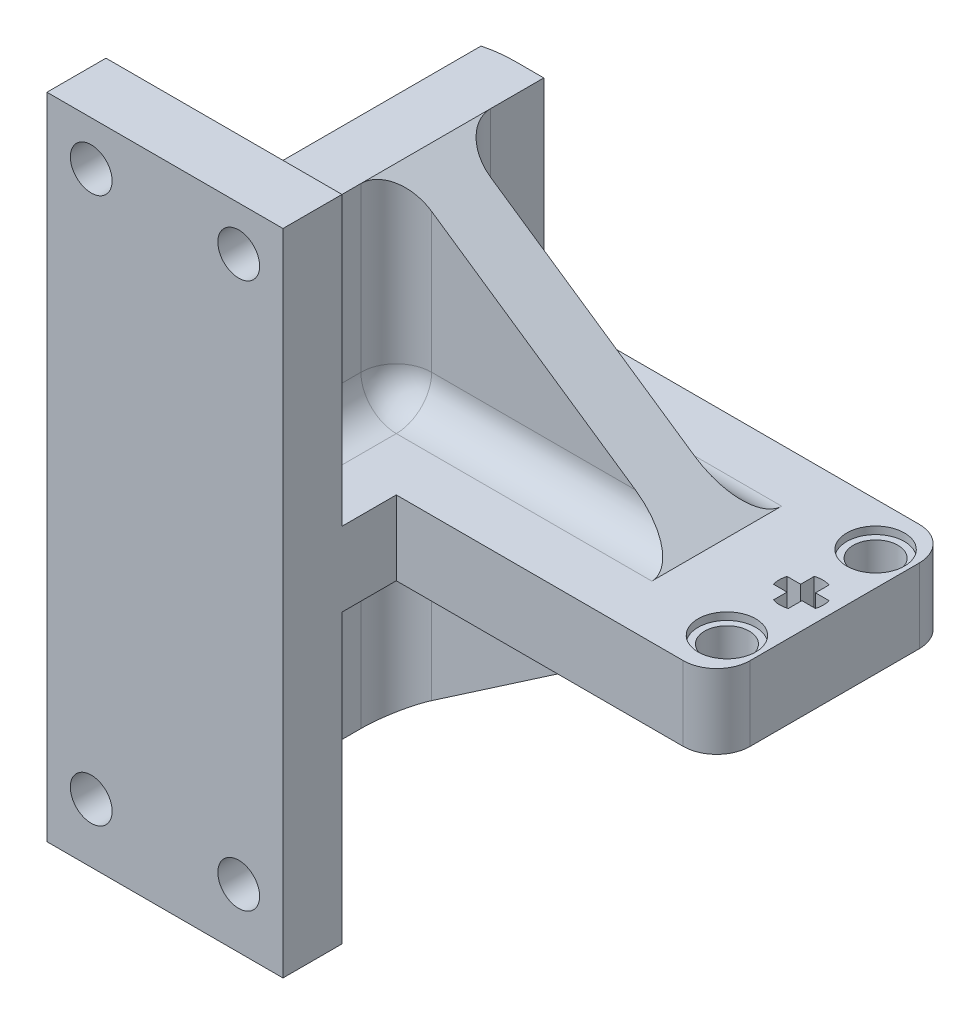
from build123d import *

# Parameters (mm, degrees)
BOSS_EXTRUDE1_DEPTH   = 4
SKETCH2_W             = 8
SKETCH2_H             = 25.4
BOSS_EXTRUDE2_DEPTH   = 8
SKETCH4_R             = 2.4
CUT_EXTRUDE1_DEPTH    = 61.853191075
SKETCH4_3_R           = 3.1
SKETCH4_3_R_2         = 2.4
CUT_EXTRUDE2_DEPTH    = 0.8
SKETCH5_W             = 25.4
SKETCH5_H             = 69.85
BOSS_EXTRUDE3_DEPTH   = 6.35
SKETCH8_W             = 31.242
SKETCH8_H             = 21.4
BOSS_EXTRUDE5_DEPTH   = 3.175
BOSS_EXTRUDE6_DEPTH   = 3.175
FILLET4_R             = 3.81
FILLET1_START         = -12.7
FILLET1_DEPTH         = 9.117148006
FILLET1_2_ANGLE       = 90
FILLET1_3_ANGLE       = 90
FILLET2_R             = 3.6
FILLET3_R             = 12.7
F_8_CLEARANCE_HOLE1_D = 4.4958


with BuildPart() as part:
    # Sketch1 → Boss-Extrude1 (new, symmetric)
    with BuildSketch(Plane(origin=(0, 0, 0), x_dir=(1, 0, 0), z_dir=(0, 1, 0))):
        Polygon((-12.7, 0), (12.7, 0), (12.7, 6.35), (12.7, 12.192), (43.18, 12.192), (43.18, 37.592), (-12.7, 37.592), (-12.7, 6.35), align=None)
    extrude(amount=BOSS_EXTRUDE1_DEPTH, both=True)

    # Sketch2 → Boss-Extrude2 (add)
    with BuildSketch(Plane(origin=(0, 4, 0), x_dir=(1, 0, 0), z_dir=(0, 1, 0))):
        with Locations((43.18, 24.892)):
            Rectangle(SKETCH2_W, SKETCH2_H)
    extrude(amount=-BOSS_EXTRUDE2_DEPTH)

    # Sketch4 → Cut-Extrude1 (cut, through all)
    with BuildSketch(Plane(origin=(0, 4, 0), x_dir=(1, 0, 0), z_dir=(0, 1, 0))):
        with Locations(Location((43.58, 16.892, 0), (0, 0, 270))):
            Circle(SKETCH4_R)
        with BuildLine():
            ThreePointArc((45.8427417, 25.62337085), (45.947727335, 24.892), (45.8427417, 24.16062915))
            Line((45.8427417, 24.16062915), (44.38, 24.16062915))
            Line((44.38, 24.16062915), (44.38, 22.69788745))
            ThreePointArc((44.38, 22.69788745), (43.58, 22.571750825), (42.78, 22.69788745))
            Line((42.78, 22.69788745), (42.78, 24.16062915))
            Line((42.78, 24.16062915), (41.3172583, 24.16062915))
            ThreePointArc((41.3172583, 24.16062915), (41.212272665, 24.892), (41.3172583, 25.62337085))
            Line((41.3172583, 25.62337085), (42.78, 25.62337085))
            Line((42.78, 25.62337085), (42.78, 27.08611255))
            ThreePointArc((42.78, 27.08611255), (43.58, 27.212249175), (44.38, 27.08611255))
            Line((44.38, 27.08611255), (44.38, 25.62337085))
            Line((44.38, 25.62337085), (45.8427417, 25.62337085))
        make_face()
        with Locations(Location((43.58, 32.892, 0), (0, 0, 270))):
            Circle(SKETCH4_R)
        with BuildLine():
            Line((42.78, 27.08611255), (42.78, 25.62337085))
            Line((42.78, 25.62337085), (44.38, 25.62337085))
            Line((44.38, 25.62337085), (44.38, 27.08611255))
            ThreePointArc((44.38, 27.08611255), (43.58, 27.212249175), (42.78, 27.08611255))
        make_face()
    extrude(amount=-CUT_EXTRUDE1_DEPTH, mode=Mode.SUBTRACT)

    # Sketch4<3> → Cut-Extrude2 (cut)
    # profile 1 of 2: a face of its own
    with BuildSketch(Plane(origin=(0, 4, 0), x_dir=(1, 0, 0), z_dir=(0, 1, 0))):
        with Locations(Location((43.58, 16.892, 0), (0, 0, 270))):
            Circle(SKETCH4_3_R)
        with Locations(Location((43.58, 16.892, 0), (0, 0, 270))):
            Circle(SKETCH4_3_R_2, mode=Mode.SUBTRACT)
    # profile 2 of 2: a face of its own
    with BuildSketch(Plane(origin=(0, 4, 0), x_dir=(1, 0, 0), z_dir=(0, 1, 0))):
        with Locations(Location((43.58, 32.892, 0), (0, 0, 270))):
            Circle(SKETCH4_3_R)
        with Locations(Location((43.58, 32.892, 0), (0, 0, 270))):
            Circle(SKETCH4_3_R_2, mode=Mode.SUBTRACT)
    cut_extrude2 = extrude(amount=-CUT_EXTRUDE2_DEPTH, mode=Mode.SUBTRACT)

    # Mirror1: Cut-Extrude2 across plane
    add(cut_extrude2.mirror(Plane.ZX), mode=Mode.SUBTRACT)

    # Sketch5 → Boss-Extrude3 (add)
    with BuildSketch(Plane.XY):
        Rectangle(SKETCH5_W, SKETCH5_H)
    extrude(amount=-BOSS_EXTRUDE3_DEPTH)

    # Sketch8 → Boss-Extrude5 (add, symmetric)
    with BuildSketch(Plane(origin=(0, 0, 0), x_dir=(0, 0, -1), z_dir=(1, 0, 0))):
        with Locations((21.971, 14.7)):
            Rectangle(SKETCH8_W, SKETCH8_H)
    boss_extrude5 = extrude(amount=BOSS_EXTRUDE5_DEPTH, both=True)

    # Sketch9 → Boss-Extrude6 (add, symmetric)
    with BuildSketch(Plane(origin=(0, 0, -24.892), x_dir=(-1, 0, 0), z_dir=(0, 0, -1))):
        Polygon((-3.175, 25.4), (-34.48, 4), (-3.175, 4), align=None)
    boss_extrude6 = extrude(amount=BOSS_EXTRUDE6_DEPTH, both=True)

    # Mirror2: Boss-Extrude5, Boss-Extrude6 across plane
    add(boss_extrude5.mirror(Plane.ZX))
    add(boss_extrude6.mirror(Plane.ZX))

    # Fillet4
    # the kernel refuses this fillet: 3.81 mm, written as the material it adds along each edge
    with BuildSketch(Plane(origin=(6.985, 7.81, -17.907), x_dir=(0, 0, -1), z_dir=(0, -1, 0))) as fillet4_piece_1_section:
        Polygon((0, 0), (FILLET4_R * 1.02, 0), (FILLET4_R * 1.02, -FILLET4_R * 1.02), (0, -FILLET4_R * 1.02), align=None)
    fillet4_piece_1 = extrude(amount=FILLET4_R * 1.02, mode=Mode.PRIVATE)
    fillet4_piece_1 = fillet4_piece_1 - Plane(origin=(6.985, 7.81, -17.907), x_dir=(0.7071067811865477, 0, 0.7071067811865475), z_dir=(0, -1, 0)) * Sphere(FILLET4_R, mode=Mode.PRIVATE)
    add(fillet4_piece_1)
    with BuildSketch(Plane(origin=(6.985, 7.81, -31.877), x_dir=(0, -1, 0), z_dir=(0, 0, 1))) as fillet4_piece_2_section:
        Polygon((0, 0), (FILLET4_R * 1.02, 0), (FILLET4_R * 1.02, -FILLET4_R * 1.02), (0, -FILLET4_R * 1.02), align=None)
    fillet4_piece_2 = extrude(amount=FILLET4_R * 1.02, mode=Mode.PRIVATE)
    fillet4_piece_2 = fillet4_piece_2 - Plane(origin=(6.985, 7.81, -31.877), x_dir=(0.7071067811865475, 0.7071067811865475, 0), z_dir=(0, 0, 1)) * Sphere(FILLET4_R, mode=Mode.PRIVATE)
    add(fillet4_piece_2)
    with BuildSketch(Plane(origin=(6.985, -7.81, -17.907), x_dir=(-1, 0, 0), z_dir=(0, 1, 0))) as fillet4_piece_3_section:
        Polygon((0, 0), (FILLET4_R * 1.02, 0), (FILLET4_R * 1.02, -FILLET4_R * 1.02), (0, -FILLET4_R * 1.02), align=None)
    fillet4_piece_3 = extrude(amount=FILLET4_R * 1.02, mode=Mode.PRIVATE)
    fillet4_piece_3 = fillet4_piece_3 - Plane(origin=(6.985, -7.81, -17.907), x_dir=(0.7071067811865477, 0, 0.7071067811865475), z_dir=(0, 1, 0)) * Sphere(FILLET4_R, mode=Mode.PRIVATE)
    add(fillet4_piece_3)
    with BuildSketch(Plane(origin=(6.985, -7.81, -31.877), x_dir=(-1, 0, 0), z_dir=(0, 0, 1))) as fillet4_piece_4_section:
        Polygon((0, 0), (FILLET4_R * 1.02, 0), (FILLET4_R * 1.02, -FILLET4_R * 1.02), (0, -FILLET4_R * 1.02), align=None)
    fillet4_piece_4 = extrude(amount=FILLET4_R * 1.02, mode=Mode.PRIVATE)
    fillet4_piece_4 = fillet4_piece_4 - Plane(origin=(6.985, -7.81, -31.877), x_dir=(0.7071067811865475, -0.7071067811865475, 0), z_dir=(0, 0, 1)) * Sphere(FILLET4_R, mode=Mode.PRIVATE)
    add(fillet4_piece_4)
    with BuildSketch(Plane(origin=(-3.175, -5.525, -6.35), x_dir=(-1, 0, 0), z_dir=(0, 1, 0)), Plane(origin=(3.175, 5.525, -6.35), x_dir=(1, 0, 0), z_dir=(0, -1, 0))) as fillet4_piece_5:
        with BuildLine():
            CenterArc((FILLET4_R, -FILLET4_R), FILLET4_R, 90, 90)
            Line((0, -FILLET4_R), (0, 0))
            Line((0, 0), (FILLET4_R, 0))
        make_face()
    extrude(amount=30.925)
    with BuildSketch(Plane(origin=(-3.175, 4, -37.592), x_dir=(-1, 0, 0), z_dir=(0, 0, 1))) as fillet4_piece_6:
        with BuildLine():
            CenterArc((FILLET4_R, -FILLET4_R), FILLET4_R, 90, 90)
            Line((0, -FILLET4_R), (0, 0))
            Line((0, 0), (FILLET4_R, 0))
        make_face()
    extrude(amount=31.242)
    with BuildSketch(Plane(origin=(3.175, -5.525, -6.35), x_dir=(1, 0, 0), z_dir=(0, 1, 0)), Plane(origin=(-3.175, 5.525, -6.35), x_dir=(-1, 0, 0), z_dir=(0, -1, 0))) as fillet4_piece_7:
        with BuildLine():
            CenterArc((FILLET4_R, FILLET4_R), FILLET4_R, 180, 90)
            Line((0, FILLET4_R), (0, 0))
            Line((0, 0), (FILLET4_R, 0))
        make_face()
    extrude(amount=30.925)
    with BuildSketch(Plane(origin=(3.175, 4, -17.907), x_dir=(1, 0, 0), z_dir=(0, 0, 1))) as fillet4_piece_8:
        with BuildLine():
            CenterArc((FILLET4_R, FILLET4_R), FILLET4_R, 180, 90)
            Line((0, FILLET4_R), (0, 0))
            Line((0, 0), (FILLET4_R, 0))
        make_face()
    extrude(amount=11.557)
    with BuildSketch(Plane(origin=(3.175, 4, -37.592), x_dir=(1, 0, 0), z_dir=(0, 0, 1))) as fillet4_piece_9:
        with BuildLine():
            CenterArc((FILLET4_R, FILLET4_R), FILLET4_R, 180, 90)
            Line((0, FILLET4_R), (0, 0))
            Line((0, 0), (FILLET4_R, 0))
        make_face()
    extrude(amount=5.715)
    with BuildSketch(Plane(origin=(3.175, 7.81, -21.717), x_dir=(0, 0, 1), z_dir=(0, 1, 0))) as fillet4_piece_10_section:
        with BuildLine():
            CenterArc((FILLET4_R, FILLET4_R), FILLET4_R, 180, 90)
            Line((0, FILLET4_R), (0, 0))
            Line((0, 0), (FILLET4_R, 0))
        make_face()
    fillet4_piece_10 = extrude(amount=27.115, mode=Mode.PRIVATE)
    fillet4_piece_10 = split(fillet4_piece_10, bisect_by=Plane(origin=(11.369936674, 19.797966944, -21.717), z_dir=(-0.5643388045531726, -0.8255432839503305, 0)), keep=Keep.TOP, mode=Mode.PRIVATE)
    add(fillet4_piece_10)
    with BuildSketch(Plane(origin=(44.005, 4, -21.717), x_dir=(0, 0, 1), z_dir=(-1, 0, 0))) as fillet4_piece_11_section:
        with BuildLine():
            CenterArc((FILLET4_R, FILLET4_R), FILLET4_R, 180, 90)
            Line((0, FILLET4_R), (0, 0))
            Line((0, 0), (FILLET4_R, 0))
        make_face()
    fillet4_piece_11 = extrude(amount=37.02, mode=Mode.PRIVATE)
    fillet4_piece_11 = split(fillet4_piece_11, bisect_by=Plane(origin=(40.971494323, -0.437565197, -21.717), z_dir=(-0.5643388045531726, -0.8255432839503305, 0)), keep=Keep.TOP, mode=Mode.PRIVATE)
    add(fillet4_piece_11)
    with BuildSketch(Plane(origin=(3.175, 7.81, -28.067), x_dir=(0, 0, -1), z_dir=(0, 1, 0))) as fillet4_piece_12_section:
        with BuildLine():
            CenterArc((FILLET4_R, -FILLET4_R), FILLET4_R, 90, 90)
            Line((0, -FILLET4_R), (0, 0))
            Line((0, 0), (FILLET4_R, 0))
        make_face()
    fillet4_piece_12 = extrude(amount=27.115, mode=Mode.PRIVATE)
    fillet4_piece_12 = split(fillet4_piece_12, bisect_by=Plane(origin=(11.369936674, 19.797966944, -28.067), z_dir=(-0.5643388045531726, -0.8255432839503305, 0)), keep=Keep.TOP, mode=Mode.PRIVATE)
    add(fillet4_piece_12)
    with BuildSketch(Plane(origin=(44.005, 4, -28.067), x_dir=(0, 0, -1), z_dir=(-1, 0, 0))) as fillet4_piece_13_section:
        with BuildLine():
            CenterArc((FILLET4_R, -FILLET4_R), FILLET4_R, 90, 90)
            Line((0, -FILLET4_R), (0, 0))
            Line((0, 0), (FILLET4_R, 0))
        make_face()
    fillet4_piece_13 = extrude(amount=37.02, mode=Mode.PRIVATE)
    fillet4_piece_13 = split(fillet4_piece_13, bisect_by=Plane(origin=(40.971494323, -0.437565197, -28.067), z_dir=(-0.5643388045531726, -0.8255432839503305, 0)), keep=Keep.TOP, mode=Mode.PRIVATE)
    add(fillet4_piece_13)
    with BuildSketch(Plane(origin=(3.175, -4, -17.907), x_dir=(1, 0, 0), z_dir=(0, 0, 1))) as fillet4_piece_14:
        with BuildLine():
            CenterArc((FILLET4_R, -FILLET4_R), FILLET4_R, 90, 90)
            Line((0, -FILLET4_R), (0, 0))
            Line((0, 0), (FILLET4_R, 0))
        make_face()
    extrude(amount=11.557)
    with BuildSketch(Plane(origin=(-3.175, -4, -37.592), x_dir=(-1, 0, 0), z_dir=(0, 0, 1))) as fillet4_piece_15:
        with BuildLine():
            CenterArc((FILLET4_R, FILLET4_R), FILLET4_R, 180, 90)
            Line((0, FILLET4_R), (0, 0))
            Line((0, 0), (FILLET4_R, 0))
        make_face()
    extrude(amount=31.242)
    with BuildSketch(Plane(origin=(3.175, -4, -37.592), x_dir=(1, 0, 0), z_dir=(0, 0, 1))) as fillet4_piece_16:
        with BuildLine():
            CenterArc((FILLET4_R, -FILLET4_R), FILLET4_R, 90, 90)
            Line((0, -FILLET4_R), (0, 0))
            Line((0, 0), (FILLET4_R, 0))
        make_face()
    extrude(amount=5.715)
    with BuildSketch(Plane(origin=(3.175, -7.81, -28.067), x_dir=(0, 0, -1), z_dir=(0, -1, 0))) as fillet4_piece_17_section:
        with BuildLine():
            CenterArc((FILLET4_R, FILLET4_R), FILLET4_R, 180, 90)
            Line((0, FILLET4_R), (0, 0))
            Line((0, 0), (FILLET4_R, 0))
        make_face()
    fillet4_piece_17 = extrude(amount=27.115, mode=Mode.PRIVATE)
    fillet4_piece_17 = split(fillet4_piece_17, bisect_by=Plane(origin=(11.369936674, -19.797966944, -28.067), z_dir=(-0.5643388045531726, 0.8255432839503305, 0)), keep=Keep.TOP, mode=Mode.PRIVATE)
    add(fillet4_piece_17)
    with BuildSketch(Plane(origin=(44.005, -4, -28.067), x_dir=(0, 0, -1), z_dir=(-1, 0, 0))) as fillet4_piece_18_section:
        with BuildLine():
            CenterArc((FILLET4_R, FILLET4_R), FILLET4_R, 180, 90)
            Line((0, FILLET4_R), (0, 0))
            Line((0, 0), (FILLET4_R, 0))
        make_face()
    fillet4_piece_18 = extrude(amount=37.02, mode=Mode.PRIVATE)
    fillet4_piece_18 = split(fillet4_piece_18, bisect_by=Plane(origin=(40.971494323, 0.437565197, -28.067), z_dir=(-0.5643388045531726, 0.8255432839503305, 0)), keep=Keep.TOP, mode=Mode.PRIVATE)
    add(fillet4_piece_18)
    with BuildSketch(Plane(origin=(3.175, -7.81, -21.717), x_dir=(0, 0, 1), z_dir=(0, -1, 0))) as fillet4_piece_19_section:
        with BuildLine():
            CenterArc((FILLET4_R, -FILLET4_R), FILLET4_R, 90, 90)
            Line((0, -FILLET4_R), (0, 0))
            Line((0, 0), (FILLET4_R, 0))
        make_face()
    fillet4_piece_19 = extrude(amount=27.115, mode=Mode.PRIVATE)
    fillet4_piece_19 = split(fillet4_piece_19, bisect_by=Plane(origin=(11.369936674, -19.797966944, -21.717), z_dir=(-0.5643388045531726, 0.8255432839503305, 0)), keep=Keep.TOP, mode=Mode.PRIVATE)
    add(fillet4_piece_19)
    with BuildSketch(Plane(origin=(44.005, -4, -21.717), x_dir=(0, 0, 1), z_dir=(-1, 0, 0))) as fillet4_piece_20_section:
        with BuildLine():
            CenterArc((FILLET4_R, -FILLET4_R), FILLET4_R, 90, 90)
            Line((0, -FILLET4_R), (0, 0))
            Line((0, 0), (FILLET4_R, 0))
        make_face()
    fillet4_piece_20 = extrude(amount=37.02, mode=Mode.PRIVATE)
    fillet4_piece_20 = split(fillet4_piece_20, bisect_by=Plane(origin=(40.971494323, 0.437565197, -21.717), z_dir=(-0.5643388045531726, 0.8255432839503305, 0)), keep=Keep.TOP, mode=Mode.PRIVATE)
    add(fillet4_piece_20)

    # Fillet1: read off the stored shape, not the designer's step
    # Fillet1 outline → Fillet1 (add)
    with BuildSketch(Plane.YZ.offset(FILLET1_START)):
        with BuildLine():
            ThreePointArc((4, -11.43), (5.487897552, -7.837897552), (9.08, -6.35))
            Line((9.08, -6.35), (4, -6.35))
            Line((4, -6.35), (4, -11.43))
        make_face()
        with BuildLine():
            Line((-4, -6.35), (-9.08, -6.35))
            ThreePointArc((-9.08, -6.35), (-5.487897552, -7.837897552), (-4, -11.43))
            Line((-4, -11.43), (-4, -6.35))
        make_face()
    extrude(amount=FILLET1_DEPTH)

    # Fillet1 2 outline → Fillet1 2 (revolve)
    with BuildSketch(Plane(origin=(0, 9.08, -11.43), x_dir=(0, 0, 1), z_dir=(0, 1, 0))):
        with BuildLine():
            Line((5.08, -3.175), (1.27, -3.175))
            ThreePointArc((1.27, -3.175), (3.964076836, -4.290923164), (5.08, -6.985))
            Line((5.08, -6.985), (5.08, -3.175))
        make_face()
    revolve(axis=Axis((0, 9.08, -11.43), (1, 0, 0)), revolution_arc=FILLET1_2_ANGLE)

    # Fillet1 3 outline → Fillet1 3 (revolve)
    with BuildSketch(Plane(origin=(0, -9.08, -11.43), x_dir=(0, 1, 0), z_dir=(0, 0, -1))):
        with BuildLine():
            Line((5.08, -3.175), (1.27, -3.175))
            ThreePointArc((1.27, -3.175), (3.964076836, -4.290923164), (5.08, -6.985))
            Line((5.08, -6.985), (5.08, -3.175))
        make_face()
    revolve(axis=Axis((0, -9.08, -11.43), (1, 0, 0)), revolution_arc=FILLET1_3_ANGLE)

    # Fillet2
    fillet2_edges = [part.edges().sort_by_distance(p)[0] for p in [
        (47.18, 0, -12.192),
        (47.18, 0, -37.592),
    ]]
    fillet(fillet2_edges, radius=FILLET2_R)

    # Fillet3
    fillet3_edges = [part.edges().sort_by_distance(p)[0] for p in [
        (-12.7, 0, -37.592),
    ]]
    fillet(fillet3_edges, radius=FILLET3_R)

    # #8 Clearance Hole1 (through all)
    with Locations(Plane(origin=(0, 0, -6.35), x_dir=(-1, 0, 0), z_dir=(0, 0, -1))):
        with Locations((7.9375, 30.1625), (-7.9375, 30.1625), (-7.9375, -28.575), (7.9375, -28.575)):
            Hole(F_8_CLEARANCE_HOLE1_D / 2)


solid = part.part
